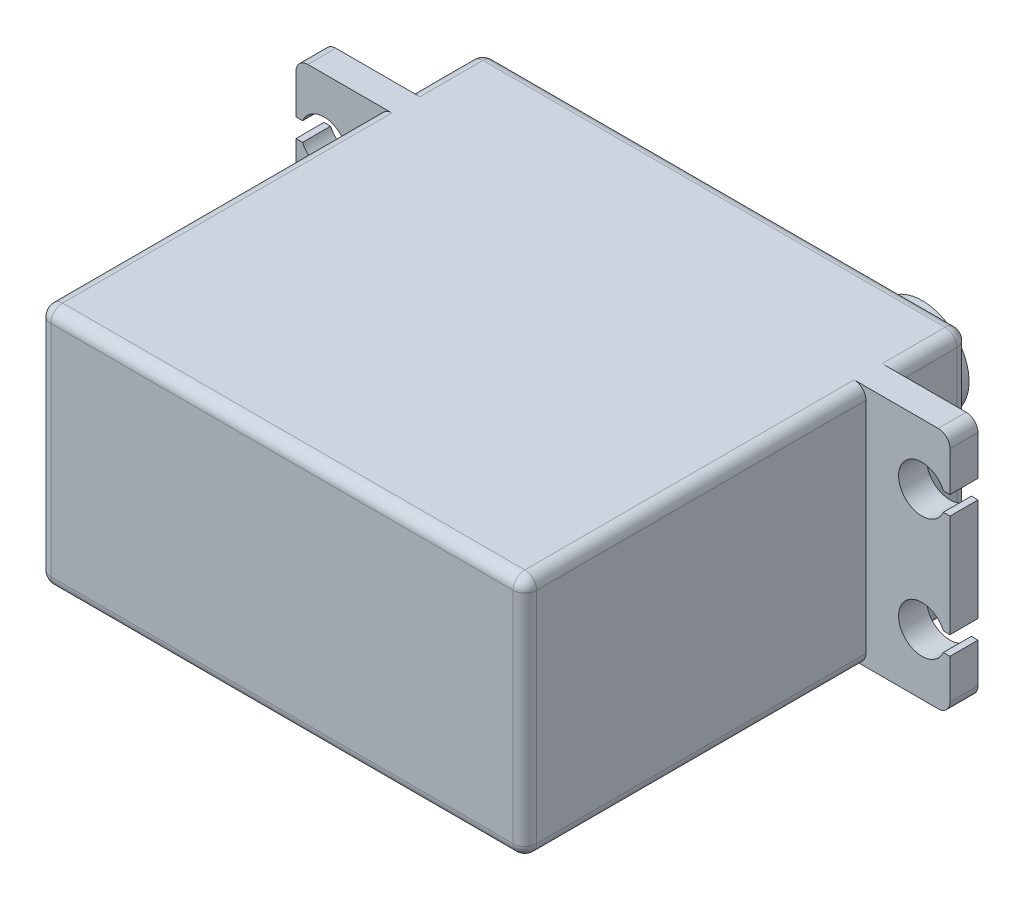
from build123d import *

# Parameters (mm, degrees)
BOSS_EXTRUDE1_DEPTH = 20.6375
CUT_EXTRUDE1_DEPTH  = 62.264183705
FILLET1_R           = 1
FILLET2_R           = 1
SKETCH3_R           = 4.7625
BOSS_EXTRUDE2_DEPTH = 3.175
FILLET3_R           = 1
SKETCH4_R           = 3.96875
BOSS_EXTRUDE3_DEPTH = 3.175


with BuildPart() as part:
    # Sketch1 → Boss-Extrude1 (new body)
    with BuildSketch(Plane(origin=(0, 0, 0), x_dir=(1, 0, 0), z_dir=(0, 1, 0))):
        Polygon((0, 0), (-41.275, 0), (-41.275, 28.971875), (-48.41875, 28.971875), (-48.41875, 31.353125), (-41.275, 31.353125), (-41.275, 37.703125), (0, 37.703125), (0, 31.353125), (7.14375, 31.353125), (7.14375, 28.971875), (0, 28.971875), align=None)
    extrude(amount=BOSS_EXTRUDE1_DEPTH)

    # Sketch2 → Cut-Extrude1 (cut, through all)
    with BuildSketch(Plane(origin=(0, 0, -31.353125), x_dir=(-1, 0, 0), z_dir=(0, 0, -1))):
        with BuildLine():
            Line((-7.14375, 16.271875), (-6.581209729, 16.271875))
            ThreePointArc((-6.581209729, 16.271875), (-2.778125, 15.478125), (-6.581209729, 14.684375))
            Line((-6.581209729, 14.684375), (-7.14375, 14.684375))
            Line((-7.14375, 14.684375), (-7.14375, 16.271875))
        make_face()
        with BuildLine():
            Line((47.856209729, 16.271875), (48.41875, 16.271875))
            Line((48.41875, 16.271875), (48.41875, 14.684375))
            Line((48.41875, 14.684375), (47.856209729, 14.684375))
            ThreePointArc((47.856209729, 14.684375), (44.053125, 15.478125), (47.856209729, 16.271875))
        make_face()
        with BuildLine():
            Line((47.856209729, 4.365625), (48.41875, 4.365625))
            Line((48.41875, 4.365625), (48.41875, 5.953125))
            Line((48.41875, 5.953125), (47.856209729, 5.953125))
            ThreePointArc((47.856209729, 5.953125), (44.053125, 5.159375), (47.856209729, 4.365625))
        make_face()
        with BuildLine():
            Line((-7.14375, 5.953125), (-6.581209729, 5.953125))
            ThreePointArc((-6.581209729, 5.953125), (-2.778125, 5.159375), (-6.581209729, 4.365625))
            Line((-6.581209729, 4.365625), (-7.14375, 4.365625))
            Line((-7.14375, 4.365625), (-7.14375, 5.953125))
        make_face()
    extrude(amount=-CUT_EXTRUDE1_DEPTH, mode=Mode.SUBTRACT)

    # Fillet1
    fillet1_edges = [part.edges().sort_by_distance(p)[0] for p in [
        (-48.41875, 20.6375, -30.1625),
        (-48.41875, 0, -30.1625),
        (7.14375, 0, -30.1625),
        (7.14375, 20.6375, -30.1625),
    ]]
    fillet(fillet1_edges, radius=FILLET1_R)

    # Fillet2
    fillet2_edges = [part.edges().sort_by_distance(p)[0] for p in [
        (-20.6375, 0, -37.703125),
        (-20.6375, 20.6375, -37.703125),
        (-41.275, 10.31875, -37.703125),
        (0, 10.31875, -37.703125),
        (-41.275, 0, -34.528125),
        (-41.275, 20.6375, -34.528125),
        (0, 0, -34.528125),
        (0, 20.6375, -34.528125),
        (0, 0, -14.4859375),
        (0, 20.6375, -14.4859375),
        (0, 10.31875, 0),
        (-20.6375, 20.6375, 0),
        (-20.6375, 0, 0),
        (-41.275, 10.31875, 0),
        (-41.275, 20.6375, -14.4859375),
        (-41.275, 0, -14.4859375),
    ]]
    fillet(fillet2_edges, radius=FILLET2_R)

    # Sketch3 → Boss-Extrude2 (add)
    with BuildSketch(Plane(origin=(0, 0, -37.703125), x_dir=(-1, 0, 0), z_dir=(0, 0, -1))):
        with Locations((10.286875, 10.31875)):
            Circle(SKETCH3_R)
    extrude(amount=BOSS_EXTRUDE2_DEPTH)

    # Fillet3
    fillet3_edges = [part.edges().sort_by_distance(p)[0] for p in [
        (-5.524375, 10.31875, -37.703125),
    ]]
    fillet(fillet3_edges, radius=FILLET3_R)

    # Sketch4 → Boss-Extrude3 (add)
    with BuildSketch(Plane(origin=(0, 0, -40.878125), x_dir=(-1, 0, 0), z_dir=(0, 0, -1))):
        with Locations((10.286875, 10.31875)):
            Circle(SKETCH4_R)
    extrude(amount=BOSS_EXTRUDE3_DEPTH)


solid = part.part
